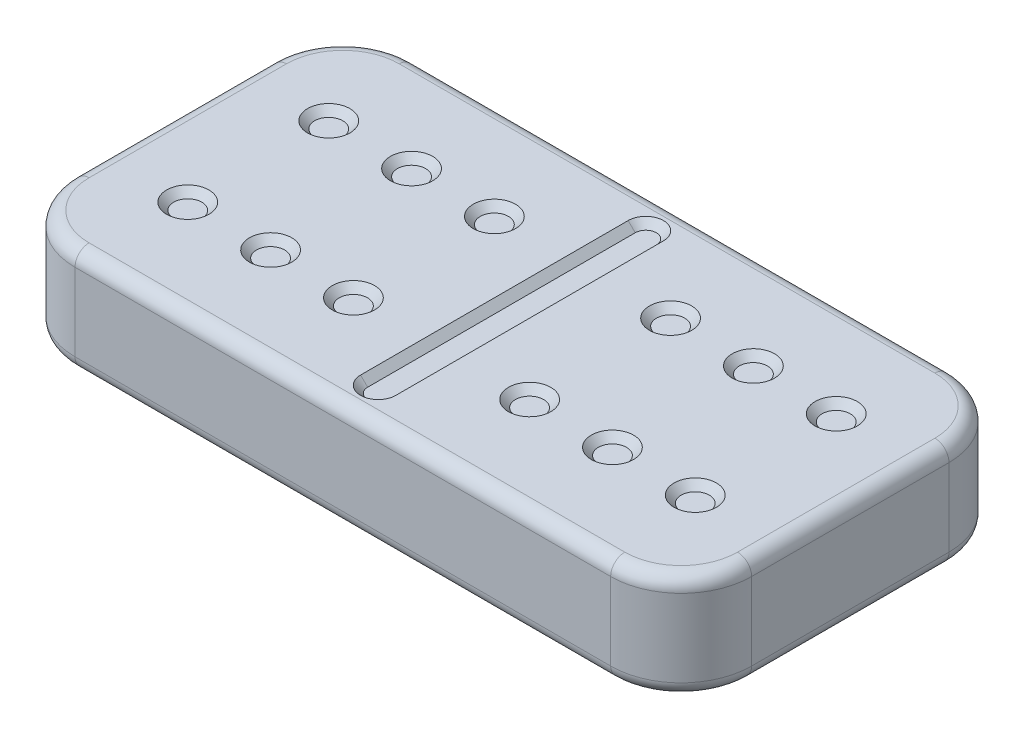
from build123d import *

# Parameters (mm, degrees)
ESQUISSE1_W                 = 48
ESQUISSE1_H                 = 24
EXTRUSION1_DEPTH            = 7.5
CONG_2_R                    = 5
CONG_5_R                    = 1
CONG_6_R                    = 1
ESQUISSE4_W                 = 0.5
ESQUISSE4_H                 = 18.982849842
EXTRUSION2_DEPTH            = 0.5
ESQUISSE5_R                 = 0.25
EXTRUSION3_DEPTH            = 0.5
CHANFREIN1_SIZE             = 1
ESQUISSE6_R                 = 1.5
EXTRUSION6_DEPTH            = 0.5
EXTRUSION6_DRAFT            = -45
EXTRUSION6_PROFILE_2_DEPTH  = 0.5
EXTRUSION6_PROFILE_2_DRAFT  = -45
EXTRUSION6_PROFILE_3_DEPTH  = 0.5
EXTRUSION6_PROFILE_3_DRAFT  = -45
EXTRUSION6_PROFILE_4_DEPTH  = 0.5
EXTRUSION6_PROFILE_4_DRAFT  = -45
EXTRUSION6_PROFILE_5_DEPTH  = 0.5
EXTRUSION6_PROFILE_5_DRAFT  = -45
EXTRUSION6_PROFILE_6_DEPTH  = 0.5
EXTRUSION6_PROFILE_6_DRAFT  = -45
EXTRUSION6_PROFILE_7_DEPTH  = 0.5
EXTRUSION6_PROFILE_7_DRAFT  = -45
EXTRUSION6_PROFILE_8_DEPTH  = 0.5
EXTRUSION6_PROFILE_8_DRAFT  = -45
EXTRUSION6_PROFILE_9_DEPTH  = 0.5
EXTRUSION6_PROFILE_9_DRAFT  = -45
EXTRUSION6_PROFILE_10_DEPTH = 0.5
EXTRUSION6_PROFILE_10_DRAFT = -45
EXTRUSION6_PROFILE_11_DEPTH = 0.5
EXTRUSION6_PROFILE_11_DRAFT = -45
EXTRUSION6_PROFILE_12_DEPTH = 0.5
EXTRUSION6_PROFILE_12_DRAFT = -45


with BuildPart() as part:
    # Esquisse1 → Extrusion1 (new body)
    with BuildSketch(Plane(origin=(0, 0, 0), x_dir=(1, 0, 0), z_dir=(0, 1, 0))):
        with Locations((24, 12)):
            Rectangle(ESQUISSE1_W, ESQUISSE1_H)
    extrude(amount=EXTRUSION1_DEPTH)

    # Congé2
    cong_2_edges = [part.edges().sort_by_distance(p)[0] for p in [
        (0, 3.75, -24),
        (48, 3.75, -24),
        (48, 3.75, 0),
        (0, 3.75, 0),
    ]]
    fillet(cong_2_edges, radius=CONG_2_R)

    # Congé5
    cong_5_edges = [part.edges().sort_by_distance(p)[0] for p in [
        (48, 7.5, -12),
        (24, 7.5, 0),
        (0, 7.5, -12),
        (24, 7.5, -24),
        (1.464466094, 7.5, -22.535533906),
        (1.464466094, 7.5, -1.464466094),
        (46.535533906, 7.5, -22.535533906),
        (46.535533906, 7.5, -1.464466094),
    ]]
    fillet(cong_5_edges, radius=CONG_5_R)

    # Congé6
    cong_6_edges = [part.edges().sort_by_distance(p)[0] for p in [
        (48, 0, -12),
        (0, 0, -12),
        (24, 0, -24),
        (24, 0, 0),
        (1.464466094, 0, -22.535533906),
        (1.464466094, 0, -1.464466094),
        (46.535533906, 0, -22.535533906),
        (46.535533906, 0, -1.464466094),
    ]]
    fillet(cong_6_edges, radius=CONG_6_R)

    # Esquisse4 → Extrusion2 (cut)
    with BuildSketch(Plane(origin=(0, 7.5, 0), x_dir=(1, 0, 0), z_dir=(0, 1, 0))):
        with Locations((24, 12)):
            Rectangle(ESQUISSE4_W, ESQUISSE4_H)
    extrude(amount=-EXTRUSION2_DEPTH, mode=Mode.SUBTRACT)

    # Esquisse5 → Extrusion3 (cut)
    with BuildSketch(Plane(origin=(0, 7.5, 0), x_dir=(1, 0, 0), z_dir=(0, 1, 0))):
        with Locations((24, 21.491424921)):
            Circle(ESQUISSE5_R)
        with Locations((24, 2.508575079)):
            Circle(ESQUISSE5_R)
    extrude(amount=-EXTRUSION3_DEPTH, mode=Mode.SUBTRACT)

    # Chanfrein1
    # the kernel refuses this chamfer: 1 mm, written as the material it takes off along each edge
    with BuildSketch(Plane(origin=(24, 7.5, -21.491424921), x_dir=(1, 0, 0), z_dir=(0, 0, 1))) as chanfrein1_piece_1_section:
        Polygon((0.25 + CHANFREIN1_SIZE, 0), (0.25, -CHANFREIN1_SIZE), (0.25, 0), align=None)
    chanfrein1_piece_1 = revolve(axis=Axis((24, 7.5, -21.491424921), (0, 1, 0)), revolution_arc=180, mode=Mode.PRIVATE)
    chanfrein1_piece_1 = split(chanfrein1_piece_1, bisect_by=Plane(origin=(24, 7, -21.964580549), z_dir=(0, 1, 0)), keep=Keep.TOP, mode=Mode.PRIVATE)
    add(chanfrein1_piece_1, mode=Mode.SUBTRACT)
    with BuildSketch(Plane(origin=(24.25, 7.5, -21.491424921), x_dir=(0.9996219169112968, 0.02749587661058651, 0), z_dir=(0, 0, 1))) as chanfrein1_piece_2_section:
        Polygon((CHANFREIN1_SIZE * 0.999621916911, -CHANFREIN1_SIZE * 0.0274958766106), (-CHANFREIN1_SIZE * 0.0274958766106, -CHANFREIN1_SIZE * 0.999621916911), (0, 0), align=None)
    chanfrein1_piece_2 = extrude(amount=18.982849842, mode=Mode.PRIVATE)
    chanfrein1_piece_2 = split(chanfrein1_piece_2, bisect_by=Plane(origin=(24.643401084, 7, -12), z_dir=(0, 1, 0)), keep=Keep.TOP, mode=Mode.PRIVATE)
    add(chanfrein1_piece_2, mode=Mode.SUBTRACT)
    with BuildSketch(Plane(origin=(24, 7.5, -2.508575079), x_dir=(-1, 0, 0), z_dir=(0, 0, -1))) as chanfrein1_piece_3_section:
        Polygon((0.25 + CHANFREIN1_SIZE, 0), (0.25, -CHANFREIN1_SIZE), (0.25, 0), align=None)
    chanfrein1_piece_3 = revolve(axis=Axis((24, 7.5, -2.508575079), (0, 1, 0)), revolution_arc=180, mode=Mode.PRIVATE)
    chanfrein1_piece_3 = split(chanfrein1_piece_3, bisect_by=Plane(origin=(24, 7, -2.035419451), z_dir=(0, 1, 0)), keep=Keep.TOP, mode=Mode.PRIVATE)
    add(chanfrein1_piece_3, mode=Mode.SUBTRACT)
    with BuildSketch(Plane(origin=(23.75, 7.5, -2.508575079), x_dir=(-0.9996219169112968, 0.02749587661058651, 0), z_dir=(0, 0, -1))) as chanfrein1_piece_4_section:
        Polygon((CHANFREIN1_SIZE * 0.999621916911, -CHANFREIN1_SIZE * 0.0274958766106), (-CHANFREIN1_SIZE * 0.0274958766106, -CHANFREIN1_SIZE * 0.999621916911), (0, 0), align=None)
    chanfrein1_piece_4 = extrude(amount=18.982849842, mode=Mode.PRIVATE)
    chanfrein1_piece_4 = split(chanfrein1_piece_4, bisect_by=Plane(origin=(23.356598916, 7, -12), z_dir=(0, 1, 0)), keep=Keep.TOP, mode=Mode.PRIVATE)
    add(chanfrein1_piece_4, mode=Mode.SUBTRACT)


with BuildPart() as extrusion6_tool:
    # Esquisse6 → Extrusion6 (with draft: the straight prism first)
    with BuildSketch(Plane(origin=(0, 7.5, 0), x_dir=(1, 0, 0), z_dir=(0, 1, 0))):
        with Locations((42, 17)):
            Circle(ESQUISSE6_R)
    extrude(amount=-EXTRUSION6_DEPTH)
    # Extrusion6: the draft: its side faces are tilted about the plane it starts from
    extrusion6_sides = [extrusion6_tool.faces().sort_by_distance(p)[0] for p in [
        (40.5, 7.25, -17),
    ]]
    draft(extrusion6_sides, Plane(origin=(0, 7.5, 0), x_dir=(1, 0, 0), z_dir=(0, 1, 0)), EXTRUSION6_DRAFT)


with BuildPart() as part_1:
    add(part.part)

    # Extrusion6: cut by extrusion6_tool
    add(extrusion6_tool.part, mode=Mode.SUBTRACT)


with BuildPart() as extrusion6_profile_2_tool:
    # Esquisse6 → Extrusion6 profile 2 (with draft: the straight prism first)
    with BuildSketch(Plane(origin=(0, 7.5, 0), x_dir=(1, 0, 0), z_dir=(0, 1, 0))):
        with Locations((36.125, 17)):
            Circle(ESQUISSE6_R)
    extrude(amount=-EXTRUSION6_PROFILE_2_DEPTH)
    # Extrusion6 profile 2: the draft: its side faces are tilted about the plane it starts from
    extrusion6_profile_2_sides = [extrusion6_profile_2_tool.faces().sort_by_distance(p)[0] for p in [
        (34.625, 7.25, -17),
    ]]
    draft(extrusion6_profile_2_sides, Plane(origin=(0, 7.5, 0), x_dir=(1, 0, 0), z_dir=(0, 1, 0)), EXTRUSION6_PROFILE_2_DRAFT)


with BuildPart() as part_2:
    add(part_1.part)

    # Extrusion6 profile 2: cut by extrusion6_profile_2_tool
    add(extrusion6_profile_2_tool.part, mode=Mode.SUBTRACT)


with BuildPart() as extrusion6_profile_3_tool:
    # Esquisse6 → Extrusion6 profile 3 (with draft: the straight prism first)
    with BuildSketch(Plane(origin=(0, 7.5, 0), x_dir=(1, 0, 0), z_dir=(0, 1, 0))):
        with Locations((11.875, 17)):
            Circle(ESQUISSE6_R)
    extrude(amount=-EXTRUSION6_PROFILE_3_DEPTH)
    # Extrusion6 profile 3: the draft: its side faces are tilted about the plane it starts from
    extrusion6_profile_3_sides = [extrusion6_profile_3_tool.faces().sort_by_distance(p)[0] for p in [
        (10.375, 7.25, -17),
    ]]
    draft(extrusion6_profile_3_sides, Plane(origin=(0, 7.5, 0), x_dir=(1, 0, 0), z_dir=(0, 1, 0)), EXTRUSION6_PROFILE_3_DRAFT)


with BuildPart() as part_3:
    add(part_2.part)

    # Extrusion6 profile 3: cut by extrusion6_profile_3_tool
    add(extrusion6_profile_3_tool.part, mode=Mode.SUBTRACT)


with BuildPart() as extrusion6_profile_4_tool:
    # Esquisse6 → Extrusion6 profile 4 (with draft: the straight prism first)
    with BuildSketch(Plane(origin=(0, 7.5, 0), x_dir=(1, 0, 0), z_dir=(0, 1, 0))):
        with Locations((17.75, 17)):
            Circle(ESQUISSE6_R)
    extrude(amount=-EXTRUSION6_PROFILE_4_DEPTH)
    # Extrusion6 profile 4: the draft: its side faces are tilted about the plane it starts from
    extrusion6_profile_4_sides = [extrusion6_profile_4_tool.faces().sort_by_distance(p)[0] for p in [
        (16.25, 7.25, -17),
    ]]
    draft(extrusion6_profile_4_sides, Plane(origin=(0, 7.5, 0), x_dir=(1, 0, 0), z_dir=(0, 1, 0)), EXTRUSION6_PROFILE_4_DRAFT)


with BuildPart() as part_4:
    add(part_3.part)

    # Extrusion6 profile 4: cut by extrusion6_profile_4_tool
    add(extrusion6_profile_4_tool.part, mode=Mode.SUBTRACT)


with BuildPart() as extrusion6_profile_5_tool:
    # Esquisse6 → Extrusion6 profile 5 (with draft: the straight prism first)
    with BuildSketch(Plane(origin=(0, 7.5, 0), x_dir=(1, 0, 0), z_dir=(0, 1, 0))):
        with Locations((6, 17)):
            Circle(ESQUISSE6_R)
    extrude(amount=-EXTRUSION6_PROFILE_5_DEPTH)
    # Extrusion6 profile 5: the draft: its side faces are tilted about the plane it starts from
    extrusion6_profile_5_sides = [extrusion6_profile_5_tool.faces().sort_by_distance(p)[0] for p in [
        (4.5, 7.25, -17),
    ]]
    draft(extrusion6_profile_5_sides, Plane(origin=(0, 7.5, 0), x_dir=(1, 0, 0), z_dir=(0, 1, 0)), EXTRUSION6_PROFILE_5_DRAFT)


with BuildPart() as part_5:
    add(part_4.part)

    # Extrusion6 profile 5: cut by extrusion6_profile_5_tool
    add(extrusion6_profile_5_tool.part, mode=Mode.SUBTRACT)


with BuildPart() as extrusion6_profile_6_tool:
    # Esquisse6 → Extrusion6 profile 6 (with draft: the straight prism first)
    with BuildSketch(Plane(origin=(0, 7.5, 0), x_dir=(1, 0, 0), z_dir=(0, 1, 0))):
        with Locations((11.875, 7)):
            Circle(ESQUISSE6_R)
    extrude(amount=-EXTRUSION6_PROFILE_6_DEPTH)
    # Extrusion6 profile 6: the draft: its side faces are tilted about the plane it starts from
    extrusion6_profile_6_sides = [extrusion6_profile_6_tool.faces().sort_by_distance(p)[0] for p in [
        (10.375, 7.25, -7),
    ]]
    draft(extrusion6_profile_6_sides, Plane(origin=(0, 7.5, 0), x_dir=(1, 0, 0), z_dir=(0, 1, 0)), EXTRUSION6_PROFILE_6_DRAFT)


with BuildPart() as part_6:
    add(part_5.part)

    # Extrusion6 profile 6: cut by extrusion6_profile_6_tool
    add(extrusion6_profile_6_tool.part, mode=Mode.SUBTRACT)


with BuildPart() as extrusion6_profile_7_tool:
    # Esquisse6 → Extrusion6 profile 7 (with draft: the straight prism first)
    with BuildSketch(Plane(origin=(0, 7.5, 0), x_dir=(1, 0, 0), z_dir=(0, 1, 0))):
        with Locations((6, 7)):
            Circle(ESQUISSE6_R)
    extrude(amount=-EXTRUSION6_PROFILE_7_DEPTH)
    # Extrusion6 profile 7: the draft: its side faces are tilted about the plane it starts from
    extrusion6_profile_7_sides = [extrusion6_profile_7_tool.faces().sort_by_distance(p)[0] for p in [
        (4.5, 7.25, -7),
    ]]
    draft(extrusion6_profile_7_sides, Plane(origin=(0, 7.5, 0), x_dir=(1, 0, 0), z_dir=(0, 1, 0)), EXTRUSION6_PROFILE_7_DRAFT)


with BuildPart() as part_7:
    add(part_6.part)

    # Extrusion6 profile 7: cut by extrusion6_profile_7_tool
    add(extrusion6_profile_7_tool.part, mode=Mode.SUBTRACT)


with BuildPart() as extrusion6_profile_8_tool:
    # Esquisse6 → Extrusion6 profile 8 (with draft: the straight prism first)
    with BuildSketch(Plane(origin=(0, 7.5, 0), x_dir=(1, 0, 0), z_dir=(0, 1, 0))):
        with Locations((17.75, 7)):
            Circle(ESQUISSE6_R)
    extrude(amount=-EXTRUSION6_PROFILE_8_DEPTH)
    # Extrusion6 profile 8: the draft: its side faces are tilted about the plane it starts from
    extrusion6_profile_8_sides = [extrusion6_profile_8_tool.faces().sort_by_distance(p)[0] for p in [
        (16.25, 7.25, -7),
    ]]
    draft(extrusion6_profile_8_sides, Plane(origin=(0, 7.5, 0), x_dir=(1, 0, 0), z_dir=(0, 1, 0)), EXTRUSION6_PROFILE_8_DRAFT)


with BuildPart() as part_8:
    add(part_7.part)

    # Extrusion6 profile 8: cut by extrusion6_profile_8_tool
    add(extrusion6_profile_8_tool.part, mode=Mode.SUBTRACT)


with BuildPart() as extrusion6_profile_9_tool:
    # Esquisse6 → Extrusion6 profile 9 (with draft: the straight prism first)
    with BuildSketch(Plane(origin=(0, 7.5, 0), x_dir=(1, 0, 0), z_dir=(0, 1, 0))):
        with Locations((30.25, 17)):
            Circle(ESQUISSE6_R)
    extrude(amount=-EXTRUSION6_PROFILE_9_DEPTH)
    # Extrusion6 profile 9: the draft: its side faces are tilted about the plane it starts from
    extrusion6_profile_9_sides = [extrusion6_profile_9_tool.faces().sort_by_distance(p)[0] for p in [
        (28.75, 7.25, -17),
    ]]
    draft(extrusion6_profile_9_sides, Plane(origin=(0, 7.5, 0), x_dir=(1, 0, 0), z_dir=(0, 1, 0)), EXTRUSION6_PROFILE_9_DRAFT)


with BuildPart() as part_9:
    add(part_8.part)

    # Extrusion6 profile 9: cut by extrusion6_profile_9_tool
    add(extrusion6_profile_9_tool.part, mode=Mode.SUBTRACT)


with BuildPart() as extrusion6_profile_10_tool:
    # Esquisse6 → Extrusion6 profile 10 (with draft: the straight prism first)
    with BuildSketch(Plane(origin=(0, 7.5, 0), x_dir=(1, 0, 0), z_dir=(0, 1, 0))):
        with Locations((30.25, 7)):
            Circle(ESQUISSE6_R)
    extrude(amount=-EXTRUSION6_PROFILE_10_DEPTH)
    # Extrusion6 profile 10: the draft: its side faces are tilted about the plane it starts from
    extrusion6_profile_10_sides = [extrusion6_profile_10_tool.faces().sort_by_distance(p)[0] for p in [
        (28.75, 7.25, -7),
    ]]
    draft(extrusion6_profile_10_sides, Plane(origin=(0, 7.5, 0), x_dir=(1, 0, 0), z_dir=(0, 1, 0)), EXTRUSION6_PROFILE_10_DRAFT)


with BuildPart() as part_10:
    add(part_9.part)

    # Extrusion6 profile 10: cut by extrusion6_profile_10_tool
    add(extrusion6_profile_10_tool.part, mode=Mode.SUBTRACT)


with BuildPart() as extrusion6_profile_11_tool:
    # Esquisse6 → Extrusion6 profile 11 (with draft: the straight prism first)
    with BuildSketch(Plane(origin=(0, 7.5, 0), x_dir=(1, 0, 0), z_dir=(0, 1, 0))):
        with Locations((42, 7)):
            Circle(ESQUISSE6_R)
    extrude(amount=-EXTRUSION6_PROFILE_11_DEPTH)
    # Extrusion6 profile 11: the draft: its side faces are tilted about the plane it starts from
    extrusion6_profile_11_sides = [extrusion6_profile_11_tool.faces().sort_by_distance(p)[0] for p in [
        (40.5, 7.25, -7),
    ]]
    draft(extrusion6_profile_11_sides, Plane(origin=(0, 7.5, 0), x_dir=(1, 0, 0), z_dir=(0, 1, 0)), EXTRUSION6_PROFILE_11_DRAFT)


with BuildPart() as part_11:
    add(part_10.part)

    # Extrusion6 profile 11: cut by extrusion6_profile_11_tool
    add(extrusion6_profile_11_tool.part, mode=Mode.SUBTRACT)


with BuildPart() as extrusion6_profile_12_tool:
    # Esquisse6 → Extrusion6 profile 12 (with draft: the straight prism first)
    with BuildSketch(Plane(origin=(0, 7.5, 0), x_dir=(1, 0, 0), z_dir=(0, 1, 0))):
        with Locations((36.125, 7)):
            Circle(ESQUISSE6_R)
    extrude(amount=-EXTRUSION6_PROFILE_12_DEPTH)
    # Extrusion6 profile 12: the draft: its side faces are tilted about the plane it starts from
    extrusion6_profile_12_sides = [extrusion6_profile_12_tool.faces().sort_by_distance(p)[0] for p in [
        (34.625, 7.25, -7),
    ]]
    draft(extrusion6_profile_12_sides, Plane(origin=(0, 7.5, 0), x_dir=(1, 0, 0), z_dir=(0, 1, 0)), EXTRUSION6_PROFILE_12_DRAFT)


with BuildPart() as part_12:
    add(part_11.part)

    # Extrusion6 profile 12: cut by extrusion6_profile_12_tool
    add(extrusion6_profile_12_tool.part, mode=Mode.SUBTRACT)


solid = part_12.part
